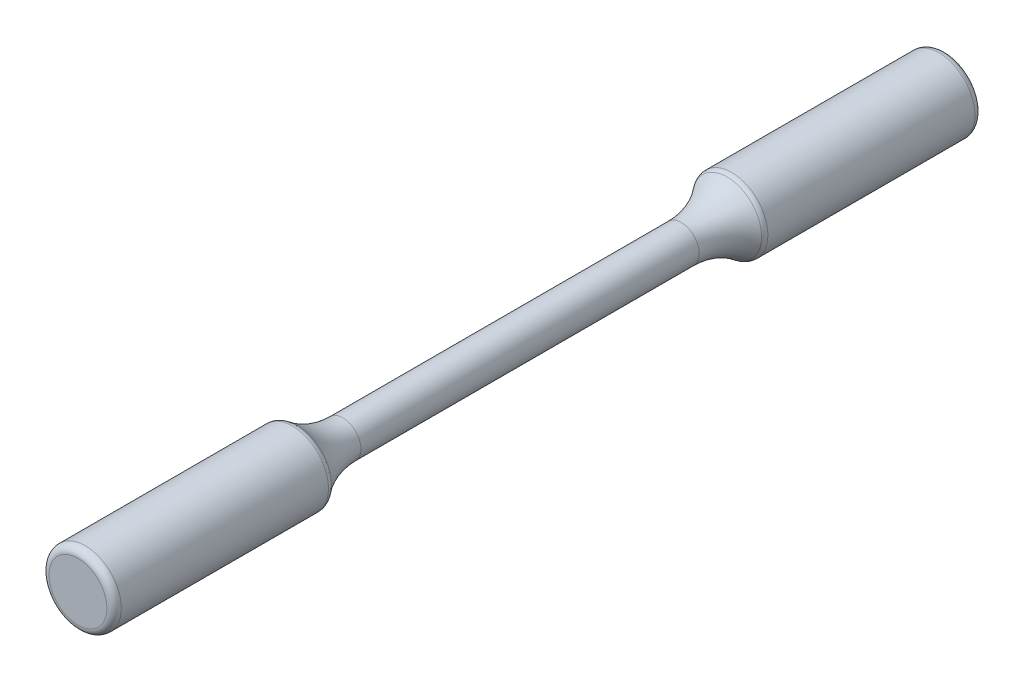
from build123d import *

# Parameters (mm, degrees)
SKETCH_1_R      = 2.5
EXTRUDE_1_DEPTH = 60
SKETCH_2_R      = 5
EXTRUDE_2_DEPTH = 30
EXTRUDE_START   = 30
SKETCH_3_R      = 5
EXTRUDE_3_DEPTH = 30
FILLET_2_R      = 10
FILLET_3_R      = 1
FILLET_4_R      = 1


with BuildPart() as part:
    # 草圖1 → 填料-伸長1 (new body)
    with BuildSketch(Plane.XY):
        Circle(SKETCH_1_R)
    extrude(amount=EXTRUDE_1_DEPTH)

    # 草圖2 → 填料-伸長2 (add)
    with BuildSketch(Plane.XY.offset(60)):
        Circle(SKETCH_2_R)
    extrude(amount=EXTRUDE_2_DEPTH)

    # 草圖3 → 填料-伸長3 (add)
    with BuildSketch(Plane(origin=(0, 0, 0), x_dir=(-1, 0, 0), z_dir=(0, 0, -1)).offset(EXTRUDE_START)):
        with Locations(Location((0, 0, 0), (0, 0, 180))):
            Circle(SKETCH_3_R)
    extrude(amount=-EXTRUDE_3_DEPTH)

    # 圓角2
    # the kernel refuses this fillet: 10 mm, written as the material it adds along each edge
    with BuildSketch(Plane(origin=(0, 0, 0), x_dir=(1, 0, 0), z_dir=(0, -1, 0))) as fillet_2_piece_1:
        with BuildLine():
            CenterArc((12.5, 6.614378278), FILLET_2_R, 180, 41.409622109)
            Line((2.5, 6.614378278), (2.3, 6.614378278))
            Line((2.3, 6.614378278), (2.3, 0))
            Line((2.3, 0), (2.5, -0.2))
            ThreePointArc((2.5, -0.2), (3.75, -0.2), (4.85, -0.132287566))
            Line((4.85, -0.132287566), (5, 0))
        make_face()
    revolve(axis=Axis((0, 0, 0), (0, 0, 1)))
    with BuildSketch(Plane(origin=(0, 0, 60), x_dir=(1, 0, 0), z_dir=(0, -1, 0))) as fillet_2_piece_2:
        with BuildLine():
            CenterArc((12.5, -6.614378278), FILLET_2_R, 138.590377891, 41.409622109)
            Line((5, 0), (4.85, 0.132287566))
            ThreePointArc((4.85, 0.132287566), (3.75, 0.2), (2.5, 0.2))
            Line((2.5, 0.2), (2.3, 0))
            Line((2.3, 0), (2.3, -6.614378278))
            Line((2.3, -6.614378278), (2.5, -6.614378278))
        make_face()
    revolve(axis=Axis((0, 0, 60), (0, 0, 1)))

    # 圓角3
    fillet_3_edges = [part.edges().sort_by_distance(p)[0] for p in [
        (-5, 0, -30),
        (-5, 0, 90),
    ]]
    fillet(fillet_3_edges, radius=FILLET_3_R)

    # 圓角4
    fillet_4_edges = [part.edges().sort_by_distance(p)[0] for p in [
        (-5, 0, 0),
        (-5, 0, 60),
    ]]
    fillet(fillet_4_edges, radius=FILLET_4_R)


solid = part.part
